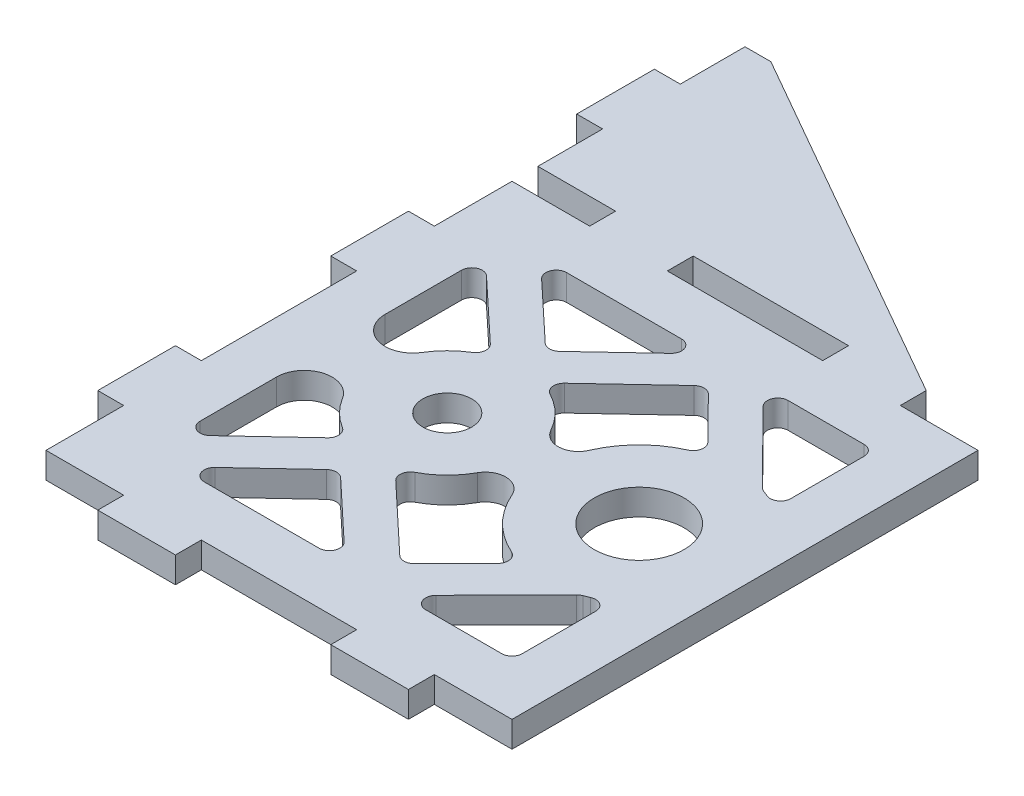
from build123d import *

# Parameters (mm, degrees)
BOSS_EXTRUDE1_DEPTH = 6.35
SKETCH2_R           = 11
SKETCH2_R_2         = 5.999988
CUT_EXTRUDE1_DEPTH  = 167.316670842
CUT_EXTRUDE3_DEPTH  = 167.316670842
FILLET2_R           = 2.54
BOSS_EXTRUDE2_DEPTH = 6.35


with BuildPart() as part:
    # Sketch1 → Boss-Extrude1 (new body)
    with BuildSketch(Plane(origin=(0, 0, 0), x_dir=(1, 0, 0), z_dir=(0, 1, 0))):
        Polygon((0, 0), (19.05, 0), (19.05, -6.35), (38.1, -6.35), (38.1, 0), (76.2, 0), (76.2, -6.35), (95.25, -6.35), (95.25, 0), (114.3, 0), (114.3, 114.3), (95.25, 114.3), (95.25, 120.65), (76.2, 120.65), (76.2, 114.3), (38.1, 114.3), (38.1, 120.65), (19.05, 120.65), (19.05, 114.3), (0, 114.3), (0, 95.25), (-6.35, 95.25), (-6.35, 76.2), (0, 76.2), (0, 38.1), (-6.35, 38.1), (-6.35, 19.05), (0, 19.05), align=None)
    extrude(amount=-BOSS_EXTRUDE1_DEPTH)

    # Sketch2 → Cut-Extrude1 (cut, through all)
    with BuildSketch(Plane(origin=(0, 0, 0), x_dir=(1, 0, 0), z_dir=(0, 1, 0))):
        with Locations((88.3412, 57.15)):
            Circle(SKETCH2_R)
        with Locations((41.275, 57.15)):
            Circle(SKETCH2_R_2)
    extrude(amount=-CUT_EXTRUDE1_DEPTH, mode=Mode.SUBTRACT)

    # Sketch6 → Cut-Extrude3 (cut, through all)
    with BuildSketch(Plane(origin=(0, 0, 0), x_dir=(1, 0, 0), z_dir=(0, 1, 0))):
        Polygon((60.699123845, 101.6), (19.665785398, 101.6), (40.212208547, 82.350538891), align=None)
        with BuildLine():
            Line((34.553231774, 74.600139917), (12.7, 95.073919323))
            Line((12.7, 95.073919323), (12.7, 70.455797113))
            ThreePointArc((12.7, 70.455797113), (17.664975151, 63.900495398), (25.320259122, 66.90375798))
            ThreePointArc((25.320259122, 66.90375798), (29.301504687, 71.514016193), (34.553231774, 74.600139917))
        make_face()
        with BuildLine():
            ThreePointArc((25.320259122, 47.39624202), (17.664975151, 50.399504602), (12.7, 43.844202887))
            Line((12.7, 43.844202887), (12.7, 19.226080677))
            Line((12.7, 19.226080677), (34.553231774, 39.699860083))
            ThreePointArc((34.553231774, 39.699860083), (29.301504687, 42.785983807), (25.320259122, 47.39624202))
        make_face()
        with BuildLine():
            Line((67.531192941, 94.949500352), (46.432078526, 75.124818282))
            ThreePointArc((46.432078526, 75.124818282), (52.940953479, 71.764892426), (57.659864907, 66.162533116))
            ThreePointArc((57.659864907, 66.162533116), (62.259694894, 63.586233382), (66.598567017, 66.581220014))
            ThreePointArc((66.598567017, 66.581220014), (72.880803224, 75.112909885), (82.252867914, 80.05463299))
            Line((82.252867914, 80.05463299), (67.531192941, 94.949500352))
        make_face()
        with BuildLine():
            Line((101.6, 101.6), (74.350321682, 101.6))
            Line((74.350321682, 101.6), (96.176053744, 79.517500236))
            ThreePointArc((96.176053744, 79.517500236), (98.975562274, 78.330187417), (101.6, 76.794190555))
            Line((101.6, 76.794190555), (101.6, 101.6))
        make_face()
        Polygon((40.212208547, 31.949461109), (19.665785398, 12.7), (60.699123845, 12.7), align=None)
        with BuildLine():
            ThreePointArc((66.598567017, 47.718779986), (62.259694894, 50.713766618), (57.659864907, 48.137466884))
            ThreePointArc((57.659864907, 48.137466884), (52.940953479, 42.535107574), (46.432078526, 39.175181718))
            Line((46.432078526, 39.175181718), (67.531192941, 19.350499648))
            Line((67.531192941, 19.350499648), (82.252867914, 34.24536701))
            ThreePointArc((82.252867914, 34.24536701), (72.880803224, 39.187090115), (66.598567017, 47.718779986))
        make_face()
        with BuildLine():
            Line((101.6, 12.7), (101.6, 37.505809445))
            ThreePointArc((101.6, 37.505809445), (98.975562274, 35.969812583), (96.176053744, 34.782499764))
            Line((96.176053744, 34.782499764), (74.350321682, 12.7))
            Line((74.350321682, 12.7), (101.6, 12.7))
        make_face()
    extrude(amount=-CUT_EXTRUDE3_DEPTH, mode=Mode.SUBTRACT)

    # Fillet2
    fillet2_edges = [part.edges().sort_by_distance(p)[0] for p in [
        (82.252867914, -3.175, -34.24536701),
        (67.531192941, -3.175, -19.350499648),
        (46.432078526, -3.175, -39.175181718),
        (46.432078526, -3.175, -75.124818282),
        (67.531192941, -3.175, -94.949500352),
        (82.252867914, -3.175, -80.05463299),
        (12.7, -3.175, -19.226080677),
        (34.553231774, -3.175, -74.600139917),
        (12.7, -3.175, -95.073919323),
        (101.6, -3.175, -37.505809445),
        (101.6, -3.175, -12.7),
        (74.350321682, -3.175, -12.7),
        (96.176053744, -3.175, -34.782499764),
        (40.212208547, -3.175, -31.949461109),
        (60.699123845, -3.175, -12.7),
        (19.665785398, -3.175, -12.7),
        (19.665785398, -3.175, -101.6),
        (60.699123845, -3.175, -101.6),
        (40.212208547, -3.175, -82.350538891),
        (96.176053744, -3.175, -79.517500236),
        (74.350321682, -3.175, -101.6),
        (101.6, -3.175, -101.6),
        (101.6, -3.175, -76.794190555),
        (34.553231774, -3.175, -39.699860083),
    ]]
    fillet(fillet2_edges, radius=FILLET2_R)

    # Sketch4 → Boss-Extrude2 (add)
    with BuildSketch(Plane(origin=(0, 0, 0), x_dir=(1, 0, 0), z_dir=(0, 1, 0))):
        Polygon((0, 171.45), (6.35, 171.45), (95.25, 120.65), (19.05, 120.65), (0, 120.65), (0, 136.525), (-6.35, 136.525), (-6.35, 155.575), (0, 155.575), align=None)
    extrude(amount=-BOSS_EXTRUDE2_DEPTH)


solid = part.part
